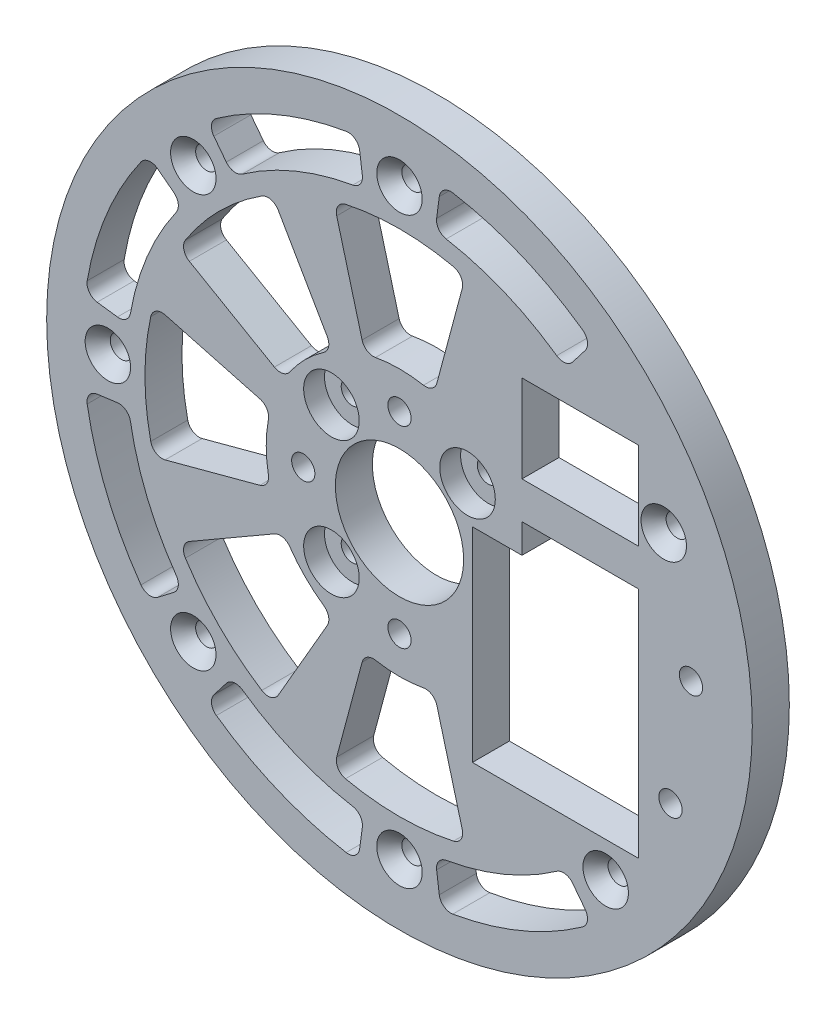
from build123d import *
from OCP.BRepFilletAPI import BRepFilletAPI_MakeChamfer

# Parameters (mm, degrees)
SKETCH1_R                = 60.5
SKETCH1_R_2              = 1.89865
SKETCH1_R_3              = 1.9939
SKETCH1_R_4              = 11
BOSS_EXTRUDE1_DEPTH      = 6.35
SKETCH2_W                = 20
SKETCH2_H                = 15
CUT_EXTRUDE1_DEPTH       = 86.795235882
CUT_EXTRUDE2_START       = -6.35
CUT_EXTRUDE2_DEPTH       = 6.35
FILLET1_R                = 2
CIRPATTERN1_COUNT        = 8
FILLET1_OF_CIRPATTERN1_R = 2
SKETCH4_R                = 1.89865
CUT_EXTRUDE3_DEPTH       = 86.795235882
FILLET2_R                = 2
CIRPATTERN2_COUNT        = 8
FILLET2_OF_CIRPATTERN2_R = 2
CHAMFER1_SIZE            = 2.301024407
CHAMFER1_SIZE2           = 2.00025
CUT_EXTRUDE4_START       = -3.571875
SKETCH5_R                = 4.7625
SKETCH5_R_2              = 1.89865
CUT_EXTRUDE4_DEPTH       = 3.571875


# Read off the part's stored shape, not the designer's step: Cut-Extrude2
with BuildPart() as part:
    # Sketch1 → Boss-Extrude1 (new body)
    with BuildSketch(Plane.XY):
        Circle(SKETCH1_R)
        with Locations((45.315389352, 21.130913087)):
            Circle(SKETCH1_R_2, mode=Mode.SUBTRACT)
        with Locations((49.978847504, 1.454235937)):
            Circle(SKETCH1_R_3, mode=Mode.SUBTRACT)
        Circle(SKETCH1_R_4, mode=Mode.SUBTRACT)
        with Locations((46.467376211, -18.460307366)):
            Circle(SKETCH1_R_3, mode=Mode.SUBTRACT)
        with Locations((0, -16.5)):
            Circle(SKETCH1_R_3, mode=Mode.SUBTRACT)
        with Locations((0, -50)):
            Circle(SKETCH1_R_2, mode=Mode.SUBTRACT)
        with Locations((-16.5, 0)):
            Circle(SKETCH1_R_3, mode=Mode.SUBTRACT)
        with Locations((-11.66726189, -11.66726189)):
            Circle(SKETCH1_R_2, mode=Mode.SUBTRACT)
        with Locations((0, 16.5)):
            Circle(SKETCH1_R_3, mode=Mode.SUBTRACT)
        with Locations((-11.66726189, 11.66726189)):
            Circle(SKETCH1_R_2, mode=Mode.SUBTRACT)
        with Locations((11.66726189, 11.66726189)):
            Circle(SKETCH1_R_2, mode=Mode.SUBTRACT)
        with Locations((-35.355339059, -35.355339059)):
            Circle(SKETCH1_R_2, mode=Mode.SUBTRACT)
        with Locations((-50, 0)):
            Circle(SKETCH1_R_2, mode=Mode.SUBTRACT)
        with Locations((-35.355339059, 35.355339059)):
            Circle(SKETCH1_R_2, mode=Mode.SUBTRACT)
        with Locations((0, 50)):
            Circle(SKETCH1_R_2, mode=Mode.SUBTRACT)
        with Locations((35.355339059, -35.355339059)):
            Circle(SKETCH1_R_2, mode=Mode.SUBTRACT)
    extrude(amount=BOSS_EXTRUDE1_DEPTH)

    # Sketch2 → Cut-Extrude1 (cut, through all)
    with BuildSketch(Plane.XY):
        Polygon((12.5, -29.35), (41, -29.35), (41, 10.65), (21, 10.65), (21, 5.65), (12.5, 5.65), align=None)
        with Locations((31, 24.5)):
            Rectangle(SKETCH2_W, SKETCH2_H)
    extrude(amount=CUT_EXTRUDE1_DEPTH, mode=Mode.SUBTRACT)

    # Cut-Extrude2 outline → Cut-Extrude2 (cut)
    with BuildSketch(Plane.XY.offset(6.35).offset(CUT_EXTRUDE2_START)):
        with BuildLine():
            ThreePointArc((-22.071405131, -5.914015181), (-22.85, 0), (-22.071405131, 5.914015181))
            Line((-22.071405131, 5.914015181), (-42.162662318, 11.297451319))
            ThreePointArc((-42.162662318, 11.297451319), (-43.65, 0), (-42.162662318, -11.297451319))
            Line((-42.162662318, -11.297451319), (-22.071405131, -5.914015181))
        make_face()
    cut_extrude2 = extrude(amount=CUT_EXTRUDE2_DEPTH, mode=Mode.SUBTRACT)

    # Fillet1
    fillet1_edges = [part.edges().sort_by_distance(p)[0] for p in [
        (-22.071405131, 5.914015181, 3.175),
        (-22.071405131, -5.914015181, 3.175),
        (-42.162662318, -11.297451319, 3.175),
        (-42.162662318, 11.297451319, 3.175),
    ]]
    fillet(fillet1_edges, radius=FILLET1_R)

    # CirPattern1: Cut-Extrude2 ×8 about axis, 3 skipped
    cirpattern1_axis = Axis((0, 0, 0), (0, 0, -1))
    add([cut_extrude2.rotate(cirpattern1_axis, i * 360 / CIRPATTERN1_COUNT) for i in range(1, CIRPATTERN1_COUNT) if i not in (3, 4, 5)], mode=Mode.SUBTRACT)

    # Fillet1 of CirPattern1
    fillet1_of_cirpattern1_edges = [part.edges().sort_by_distance(p)[0] for p in [
        (-11.425, 19.788680477, 3.175),
        (-19.788680477, 11.425, 3.175),
        (-37.802008876, 21.825, 3.175),
        (-21.825, 37.802008876, 3.175),
        (5.914015181, 22.071405131, 3.175),
        (-5.914015181, 22.071405131, 3.175),
        (-11.297451319, 42.162662318, 3.175),
        (11.297451319, 42.162662318, 3.175),
        (-5.914015181, -22.071405131, 3.175),
        (5.914015181, -22.071405131, 3.175),
        (11.297451319, -42.162662318, 3.175),
        (-11.297451319, -42.162662318, 3.175),
        (-19.788680477, -11.425, 3.175),
        (-11.425, -19.788680477, 3.175),
        (-21.825, -37.802008876, 3.175),
        (-37.802008876, -21.825, 3.175),
    ]]
    fillet(fillet1_of_cirpattern1_edges, radius=FILLET1_OF_CIRPATTERN1_R)

    # Sketch4 → Cut-Extrude3 (cut, through all)
    with BuildSketch(Plane.XY.offset(6.35)):
        with Locations((-50, 0)):
            Circle(SKETCH4_R)
        with BuildLine():
            Line((-43.098920211, 33.070964631), (-37.148770159, 28.505253913))
            ThreePointArc((-37.148770159, 28.505253913), (-43.26065911, 17.91915172), (-46.424405634, 6.111888951))
            Line((-46.424405634, 6.111888951), (-53.860242094, 7.090835392))
            ThreePointArc((-53.860242094, 7.090835392), (-50.189755604, 20.789277463), (-43.098920211, 33.070964631))
        make_face()
    cut_extrude3 = extrude(amount=-CUT_EXTRUDE3_DEPTH, mode=Mode.SUBTRACT)

    # Fillet2
    fillet2_edges = [part.edges().sort_by_distance(p)[0] for p in [
        (-37.148770159, 28.505253913, 3.175),
        (-46.424405634, 6.111888951, 3.175),
        (-53.860242094, 7.090835392, 3.175),
        (-43.098920211, 33.070964631, 3.175),
    ]]
    fillet(fillet2_edges, radius=FILLET2_R)

    # CirPattern2: Cut-Extrude3 ×8 about axis, 2 skipped
    cirpattern2_axis = Axis((0, 0, 0), (0, 0, -1))
    add([cut_extrude3.rotate(cirpattern2_axis, i * 360 / CIRPATTERN2_COUNT) for i in range(1, CIRPATTERN2_COUNT) if i not in (3, 4)], mode=Mode.SUBTRACT)

    # Fillet2 of CirPattern2
    fillet2_of_cirpattern2_edges = [part.edges().sort_by_distance(p)[0] for p in [
        (-6.111888951, 46.424405634, 3.175),
        (-28.505253913, 37.148770159, 3.175),
        (-33.070964631, 43.098920211, 3.175),
        (-7.090835392, 53.860242094, 3.175),
        (28.505253913, 37.148770159, 3.175),
        (6.111888951, 46.424405634, 3.175),
        (7.090835392, 53.860242094, 3.175),
        (33.070964631, 43.098920211, 3.175),
        (6.111888951, -46.424405634, 3.175),
        (28.505253913, -37.148770159, 3.175),
        (33.070964631, -43.098920211, 3.175),
        (7.090835392, -53.860242094, 3.175),
        (-28.505253913, -37.148770159, 3.175),
        (-6.111888951, -46.424405634, 3.175),
        (-7.090835392, -53.860242094, 3.175),
        (-33.070964631, -43.098920211, 3.175),
        (-46.424405634, -6.111888951, 3.175),
        (-37.148770159, -28.505253913, 3.175),
        (-43.098920211, -33.070964631, 3.175),
        (-53.860242094, -7.090835392, 3.175),
    ]]
    fillet(fillet2_of_cirpattern2_edges, radius=FILLET2_OF_CIRPATTERN2_R)

    # Chamfer1: one chamfer whose edges measure the first distance from different faces: ONE call of the kernel's chamfer builder (chamfer() names one face for all edges)
    chamfer1_edges_1 = [part.edges().sort_by_distance(p)[0] for p in [
        (-1.89865, -50, 6.35),
    ]]
    chamfer1_side_1 = [part.faces().sort_by_distance(p)[0] for p in [
        (-1.89865, -50, 3.175),
    ]]
    chamfer1_edges_2 = [part.edges().sort_by_distance(p)[0] for p in [
        (-37.253989059, -35.355339059, 6.35),
    ]]
    chamfer1_side_2 = [part.faces().sort_by_distance(p)[0] for p in [
        (-37.253989059, -35.355339059, 3.175),
    ]]
    chamfer1_edges_3 = [part.edges().sort_by_distance(p)[0] for p in [
        (-51.89865, 0, 6.35),
    ]]
    chamfer1_side_3 = [part.faces().sort_by_distance(p)[0] for p in [
        (-51.89865, 0, 3.175),
    ]]
    chamfer1_edges_4 = [part.edges().sort_by_distance(p)[0] for p in [
        (43.416739352, 21.130913087, 6.35),
    ]]
    chamfer1_side_4 = [part.faces().sort_by_distance(p)[0] for p in [
        (43.416739352, 21.130913087, 3.175),
    ]]
    chamfer1_edges_5 = [part.edges().sort_by_distance(p)[0] for p in [
        (-37.253989059, 35.355339059, 6.35),
    ]]
    chamfer1_side_5 = [part.faces().sort_by_distance(p)[0] for p in [
        (-37.253989059, 35.355339059, 3.175),
    ]]
    chamfer1_edges_6 = [part.edges().sort_by_distance(p)[0] for p in [
        (-1.89865, 50, 6.35),
    ]]
    chamfer1_side_6 = [part.faces().sort_by_distance(p)[0] for p in [
        (-1.89865, 50, 3.175),
    ]]
    chamfer1_edges_7 = [part.edges().sort_by_distance(p)[0] for p in [
        (33.456689059, -35.355339059, 6.35),
    ]]
    chamfer1_side_7 = [part.faces().sort_by_distance(p)[0] for p in [
        (33.456689059, -35.355339059, 3.175),
    ]]
    chamfer1 = BRepFilletAPI_MakeChamfer(part.part.solid().wrapped)
    for e in chamfer1_edges_1:
        chamfer1.Add(CHAMFER1_SIZE, CHAMFER1_SIZE2, e.wrapped, chamfer1_side_1[0].wrapped)  # the first distance lies on this face
    for e in chamfer1_edges_2:
        chamfer1.Add(CHAMFER1_SIZE, CHAMFER1_SIZE2, e.wrapped, chamfer1_side_2[0].wrapped)  # the first distance lies on this face
    for e in chamfer1_edges_3:
        chamfer1.Add(CHAMFER1_SIZE, CHAMFER1_SIZE2, e.wrapped, chamfer1_side_3[0].wrapped)  # the first distance lies on this face
    for e in chamfer1_edges_4:
        chamfer1.Add(CHAMFER1_SIZE, CHAMFER1_SIZE2, e.wrapped, chamfer1_side_4[0].wrapped)  # the first distance lies on this face
    for e in chamfer1_edges_5:
        chamfer1.Add(CHAMFER1_SIZE, CHAMFER1_SIZE2, e.wrapped, chamfer1_side_5[0].wrapped)  # the first distance lies on this face
    for e in chamfer1_edges_6:
        chamfer1.Add(CHAMFER1_SIZE, CHAMFER1_SIZE2, e.wrapped, chamfer1_side_6[0].wrapped)  # the first distance lies on this face
    for e in chamfer1_edges_7:
        chamfer1.Add(CHAMFER1_SIZE, CHAMFER1_SIZE2, e.wrapped, chamfer1_side_7[0].wrapped)  # the first distance lies on this face
    add(Compound.cast(chamfer1.Shape()), mode=Mode.REPLACE)

    # Sketch5 → Cut-Extrude4 (cut)
    # profile 1 of 3: a face of its own
    with BuildSketch(Plane.XY.offset(6.35).offset(CUT_EXTRUDE4_START)):
        with Locations((11.66726189, 11.66726189)):
            Circle(SKETCH5_R)
        with Locations((11.66726189, 11.66726189)):
            Circle(SKETCH5_R_2, mode=Mode.SUBTRACT)
    # profile 2 of 3: a face of its own
    with BuildSketch(Plane.XY.offset(6.35).offset(CUT_EXTRUDE4_START)):
        with Locations((-11.66726189, 11.66726189)):
            Circle(SKETCH5_R)
        with Locations((-11.66726189, 11.66726189)):
            Circle(SKETCH5_R_2, mode=Mode.SUBTRACT)
    # profile 3 of 3: a face of its own
    with BuildSketch(Plane.XY.offset(6.35).offset(CUT_EXTRUDE4_START)):
        with Locations((-11.66726189, -11.66726189)):
            Circle(SKETCH5_R)
        with Locations((-11.66726189, -11.66726189)):
            Circle(SKETCH5_R_2, mode=Mode.SUBTRACT)
    extrude(amount=CUT_EXTRUDE4_DEPTH, mode=Mode.SUBTRACT)


solid = part.part
